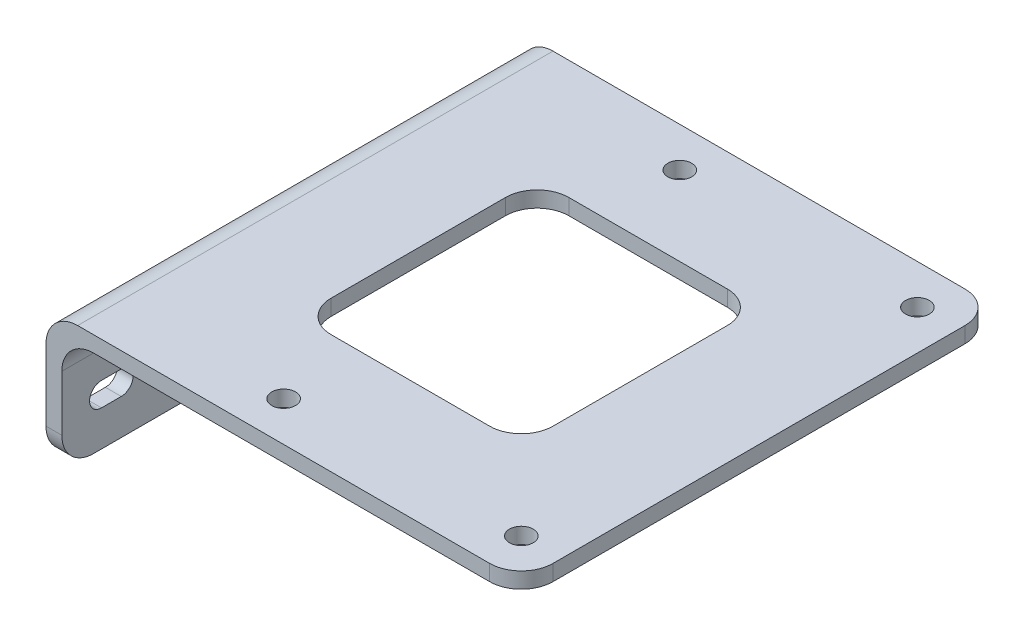
from build123d import *

# Parameters (mm, degrees)
SKETCH_1_W          = 40
SKETCH_1_H          = 60
SKETCH_1_R          = 1.5
EXTRUDE_1_DEPTH     = 2
SKETCH_2_W          = 60
SKETCH_2_H          = 2
EXTRUDE_2_DEPTH     = 20
SKETCH_3_W          = 2
SKETCH_3_H          = 60
EXTRUDE_3_DEPTH     = 15
FILLET_1_R          = 4
CUT_EXTRUDE_1_DEPTH = 69.738635424
SKETCH_7_W          = 28
SKETCH_7_H          = 30
CUT_EXTRUDE_2_DEPTH = 53.810983706
FILLET_3_R          = 4


with BuildPart() as part:
    # 草图1 → 凸台-拉伸1 (new body)
    with BuildSketch(Plane(origin=(0, 0, 0), x_dir=(1, 0, 0), z_dir=(0, 1, 0))):
        Rectangle(SKETCH_1_W, SKETCH_1_H)
        with Locations((-15, 25)):
            Circle(SKETCH_1_R, mode=Mode.SUBTRACT)
        with Locations((15, 25)):
            Circle(SKETCH_1_R, mode=Mode.SUBTRACT)
        with Locations((15, -25)):
            Circle(SKETCH_1_R, mode=Mode.SUBTRACT)
        with Locations((-15, -25)):
            Circle(SKETCH_1_R, mode=Mode.SUBTRACT)
    extrude(amount=EXTRUDE_1_DEPTH)

    # 草图2 → 凸台-拉伸2 (add)
    with BuildSketch(Plane.ZY.offset(20)):
        with Locations((0, 1)):
            Rectangle(SKETCH_2_W, SKETCH_2_H)
    extrude(amount=EXTRUDE_2_DEPTH)

    # 草图3 → 凸台-拉伸3 (add)
    with BuildSketch(Plane.XZ):
        with Locations((-39, 0)):
            Rectangle(SKETCH_3_W, SKETCH_3_H)
    extrude(amount=EXTRUDE_3_DEPTH)

    # 圆角1
    fillet_1_edges = [part.edges().sort_by_distance(p)[0] for p in [
        (-40, 2, 0),
        (-38, 0, 0),
        (-39, -15, -30),
        (-39, -15, 30),
        (20, 1, -30),
        (20, 1, 30),
    ]]
    fillet(fillet_1_edges, radius=FILLET_1_R)

    # 草图6 → 切除-拉伸1 (cut, through all)
    with BuildSketch(Plane.ZY.offset(40)):
        with BuildLine():
            Line((-25, -7.5), (-22.5, -7.5))
            ThreePointArc((-22.5, -7.5), (-21, -9), (-22.5, -10.5))
            Line((-22.5, -10.5), (-25, -10.5))
            ThreePointArc((-25, -10.5), (-26.5, -9), (-25, -7.5))
        make_face()
        with BuildLine():
            Line((25, -7.5), (22.5, -7.5))
            ThreePointArc((22.5, -7.5), (21, -9), (22.5, -10.5))
            Line((22.5, -10.5), (25, -10.5))
            ThreePointArc((25, -10.5), (26.5, -9), (25, -7.5))
        make_face()
    extrude(amount=-CUT_EXTRUDE_1_DEPTH, mode=Mode.SUBTRACT)

    # 草图7 → 切除-拉伸2 (cut, through all)
    with BuildSketch(Plane(origin=(0, 2, 0), x_dir=(1, 0, 0), z_dir=(0, 1, 0))):
        with Locations((-9, 0)):
            Rectangle(SKETCH_7_W, SKETCH_7_H)
    extrude(amount=-CUT_EXTRUDE_2_DEPTH, mode=Mode.SUBTRACT)

    # 圆角3
    fillet_3_edges = [part.edges().sort_by_distance(p)[0] for p in [
        (-23, 1, 15),
        (5, 1, 15),
        (5, 1, -15),
        (-23, 1, -15),
    ]]
    fillet(fillet_3_edges, radius=FILLET_3_R)


solid = part.part
